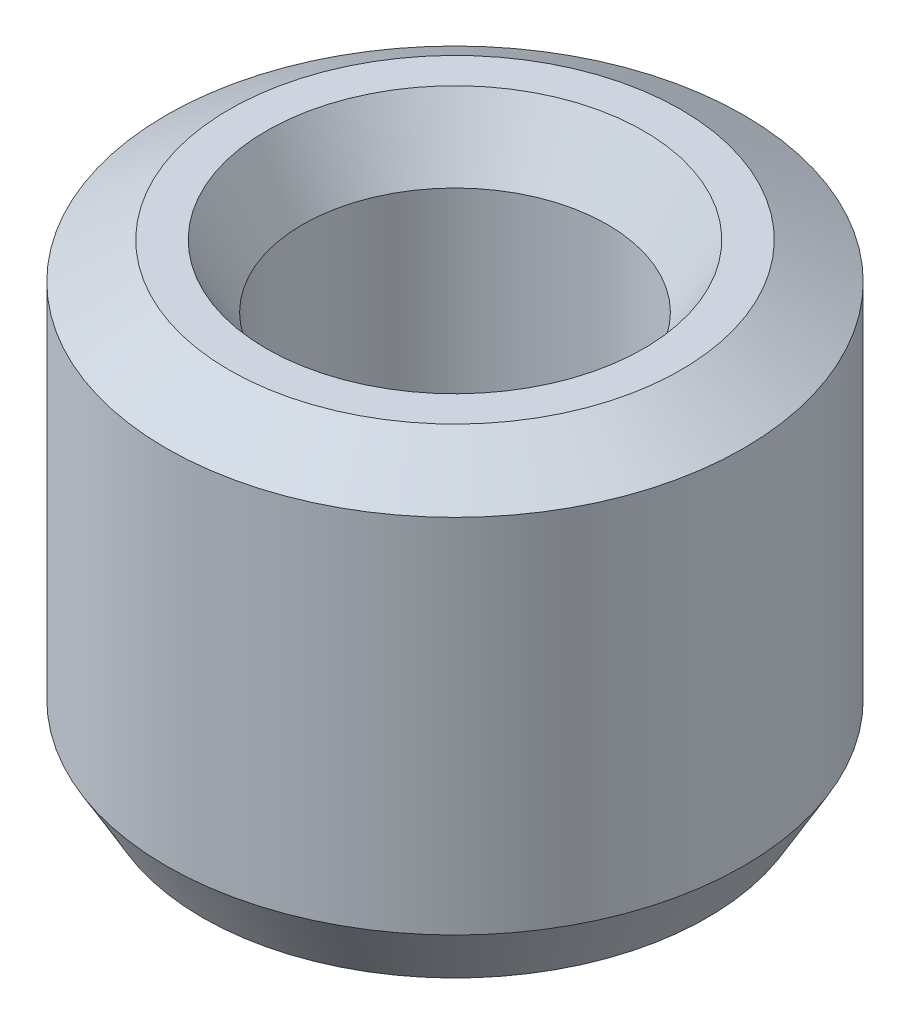
from build123d import *
from OCP.BRepFilletAPI import BRepFilletAPI_MakeChamfer

# Parameters (mm, degrees)
SKETCH1_R           = 27.5
BOSS_EXTRUDE1_DEPTH = 43.912158054
SKETCH2_R           = 14.51306271
CUT_EXTRUDE1_DEPTH  = 59.658142018
CHAMFER1_SIZE       = 3.459496347
CHAMFER1_SIZE2      = 5.992023442


with BuildPart() as part:
    # Sketch1 → Boss-Extrude1 (new body)
    with BuildSketch(Plane(origin=(0, 0, 0), x_dir=(1, 0, 0), z_dir=(0, 1, 0))):
        Circle(SKETCH1_R)
    extrude(amount=BOSS_EXTRUDE1_DEPTH)

    # Sketch2 → Cut-Extrude1 (cut, through all)
    with BuildSketch(Plane(origin=(0, 0, 0), x_dir=(1, 0, 0), z_dir=(0, 1, 0))):
        Circle(SKETCH2_R)
    extrude(amount=CUT_EXTRUDE1_DEPTH, mode=Mode.SUBTRACT)

    # Chamfer1: one chamfer whose edges measure the first distance from different faces: ONE call of the kernel's chamfer builder (chamfer() names one face for all edges)
    chamfer1_edges_1 = [part.edges().sort_by_distance(p)[0] for p in [
        (-14.51306271, 43.912158054, 0),
    ]]
    chamfer1_side_1 = [part.faces().sort_by_distance(p)[0] for p in [
        (-26.722182541, 43.912158054, 0),
    ]]
    chamfer1_edges_2 = [part.edges().sort_by_distance(p)[0] for p in [
        (-14.51306271, 0, 0),
    ]]
    chamfer1_side_2 = [part.faces().sort_by_distance(p)[0] for p in [
        (-14.51306271, 21.956079027, 0),
    ]]
    chamfer1_edges_3 = [part.edges().sort_by_distance(p)[0] for p in [
        (-27.5, 0, 0),
    ]]
    chamfer1_side_3 = [part.faces().sort_by_distance(p)[0] for p in [
        (-26.722182541, 0, 0),
    ]]
    chamfer1_edges_4 = [part.edges().sort_by_distance(p)[0] for p in [
        (-27.5, 43.912158054, 0),
    ]]
    chamfer1_side_4 = [part.faces().sort_by_distance(p)[0] for p in [
        (-27.5, 21.956079027, 0),
    ]]
    chamfer1 = BRepFilletAPI_MakeChamfer(part.part.solid().wrapped)
    for e in chamfer1_edges_1:
        chamfer1.Add(CHAMFER1_SIZE, CHAMFER1_SIZE2, e.wrapped, chamfer1_side_1[0].wrapped)  # the first distance lies on this face
    for e in chamfer1_edges_2:
        chamfer1.Add(CHAMFER1_SIZE, CHAMFER1_SIZE2, e.wrapped, chamfer1_side_2[0].wrapped)  # the first distance lies on this face
    for e in chamfer1_edges_3:
        chamfer1.Add(CHAMFER1_SIZE, CHAMFER1_SIZE2, e.wrapped, chamfer1_side_3[0].wrapped)  # the first distance lies on this face
    for e in chamfer1_edges_4:
        chamfer1.Add(CHAMFER1_SIZE, CHAMFER1_SIZE2, e.wrapped, chamfer1_side_4[0].wrapped)  # the first distance lies on this face
    add(Compound.cast(chamfer1.Shape()), mode=Mode.REPLACE)


solid = part.part
